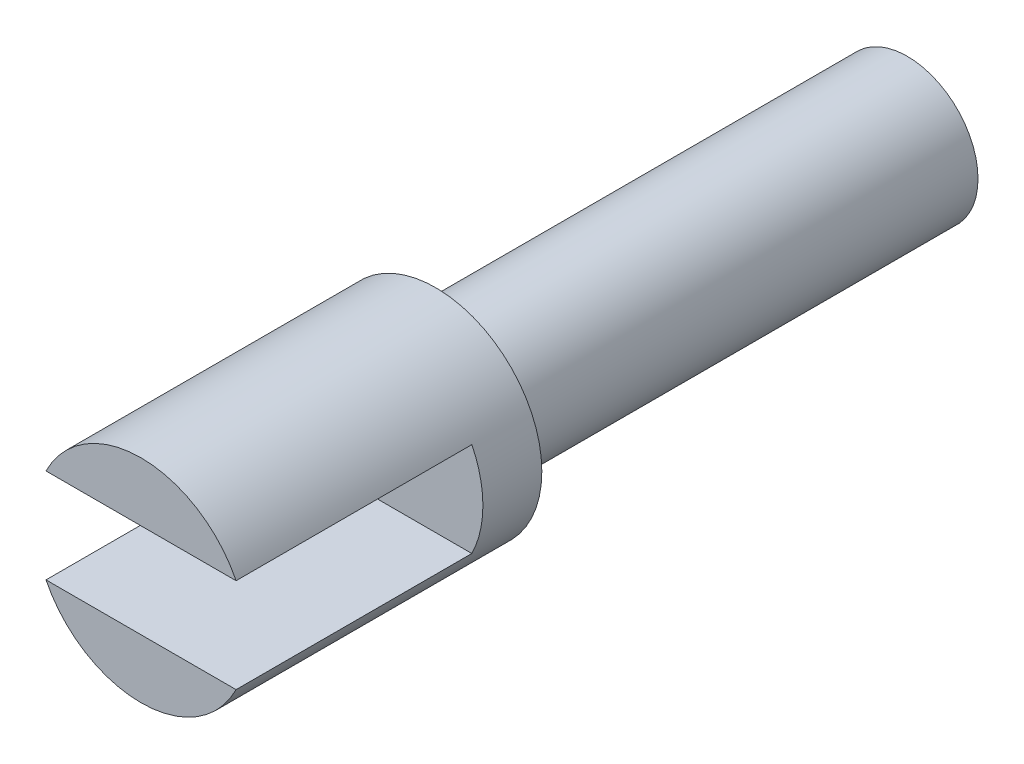
from build123d import *

# Parameters (mm, degrees)
SZKIC2_W                   = 18
SZKIC2_H                   = 8
WYTNIJ_WYCI_GNI_CIE1_DEPTH = 20


with BuildPart() as part:
    # Szkic1 → Obrót1 (revolve)
    with BuildSketch(Plane(origin=(0, 0, 0), x_dir=(1, 0, 0), z_dir=(0, 1, 0))):
        Polygon((0, -25), (9, -25), (9, 0), (6, 0), (6, 40), (0, 40), align=None)
    revolve(axis=Axis((0, 0, 44.409951059), (0, 0, -1)))

    # Szkic2 → Wytnij-wyciągnięcie1 (cut)
    with BuildSketch(Plane.XY.offset(25)):
        Rectangle(SZKIC2_W, SZKIC2_H)
    extrude(amount=-WYTNIJ_WYCI_GNI_CIE1_DEPTH, mode=Mode.SUBTRACT)


solid = part.part
